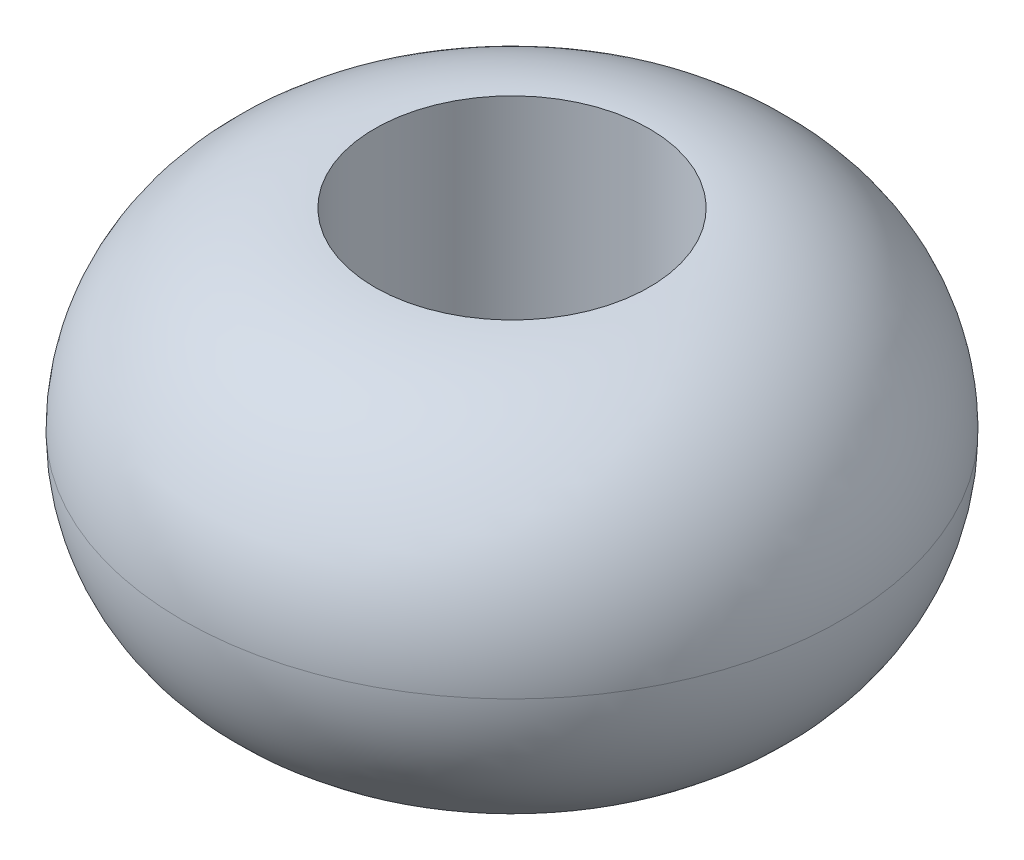
from build123d import *

# Parameters (mm, degrees)
SZKIC1_R                    = 60
DODANIE_WYCI_GNI_CIE1_DEPTH = 70
SZKIC2_R                    = 25
WYTNIJ_WYCI_GNI_CIE1_DEPTH  = 70
ZAOKR_GLENIE2_R             = 35


with BuildPart() as part:
    # Szkic1 → Dodanie-wyciągnięcie1 (new body)
    with BuildSketch(Plane(origin=(0, 0, 0), x_dir=(1, 0, 0), z_dir=(0, 1, 0))):
        with Locations(Location((0, 0, 0), (0, 0, 270))):
            Circle(SZKIC1_R)
    extrude(amount=DODANIE_WYCI_GNI_CIE1_DEPTH)

    # Szkic2 → Wytnij-wyciągnięcie1 (cut)
    with BuildSketch(Plane(origin=(0, 70, 0), x_dir=(1, 0, 0), z_dir=(0, 1, 0))):
        with Locations(Location((0, 0, 0), (0, 0, 270))):
            Circle(SZKIC2_R)
    extrude(amount=-WYTNIJ_WYCI_GNI_CIE1_DEPTH, mode=Mode.SUBTRACT)

    # Zaokrąglenie2
    zaokr_glenie2_edges = [part.edges().sort_by_distance(p)[0] for p in [
        (0, 0, -60),
        (0, 70, -60),
    ]]
    fillet(zaokr_glenie2_edges, radius=ZAOKR_GLENIE2_R - 0.0001)  # a hair under: the kernel refuses the full size


solid = part.part
